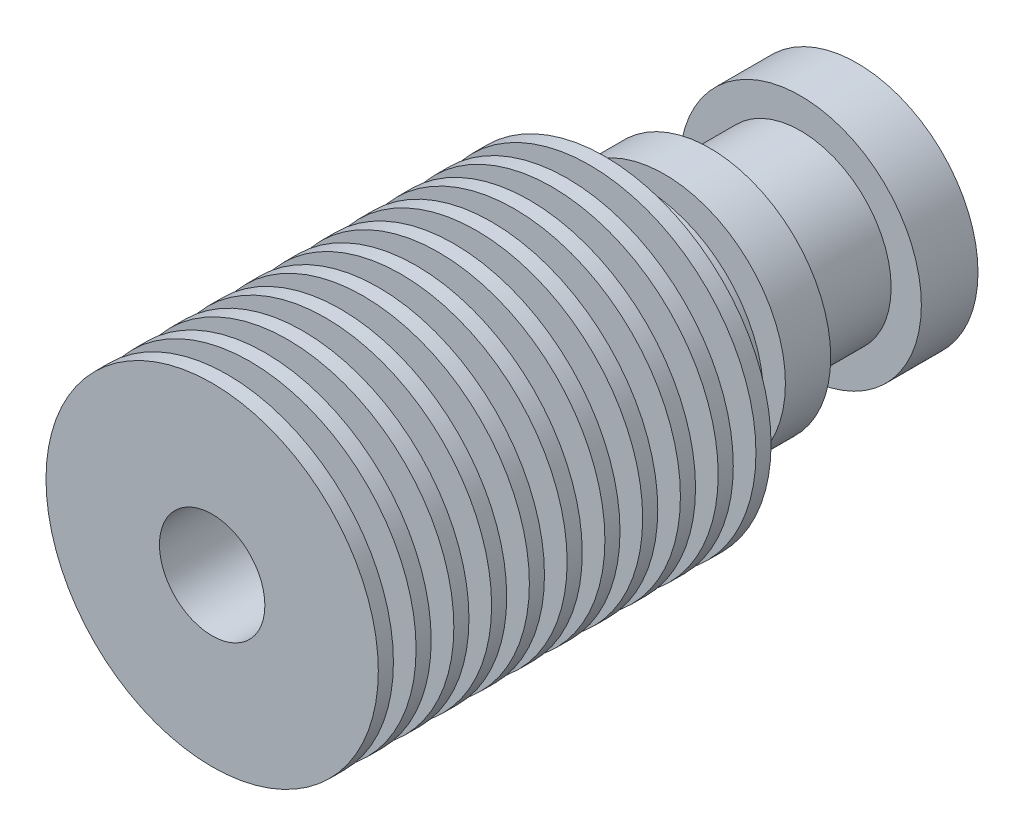
from build123d import *


with BuildPart() as part:
    # Sketch1 → Revolve1 (revolve)
    with BuildSketch(Plane(origin=(0, 0, 0), x_dir=(1, 0, 0), z_dir=(0, 1, 0))):
        Polygon((3.489063749, 0), (11, 0), (11, 1), (6.15, 1), (6.15, 2.5), (11, 2.5), (11, 3.5), (6.05, 3.5), (6.05, 5), (11, 5), (11, 6), (5.95, 6), (5.95, 7.5), (11, 7.5), (11, 8.5), (5.7, 8.5), (5.7, 10), (11, 10), (11, 11), (5.5, 11), (5.5, 12.5), (11, 12.5), (11, 13.5), (5.4, 13.5), (5.4, 15), (11, 15), (11, 16), (5.2, 16), (5.2, 17.5), (11, 17.5), (11, 18.5), (5, 18.5), (5, 20), (11, 20), (11, 21), (4.8, 21), (4.8, 22.5), (11, 22.5), (11, 23.5), (4.6, 23.5), (4.6, 25), (11, 25), (11, 26), (4.4, 26), (4.4, 27.5), (8, 27.5), (8, 28.5), (4.4, 28.5), (4.4, 29.95), (8, 29.95), (8, 32.95), (6, 32.95), (6, 38.95), (8, 38.95), (8, 42.7), (2.15853318, 42.7), (2.15853318, 32.7), (1.014965601, 31.507859286), (1.014965601, 15), (3.489063749, 15), align=None)
    revolve(axis=Axis((0, 0, 0), (0, 0, -1)))


solid = part.part
